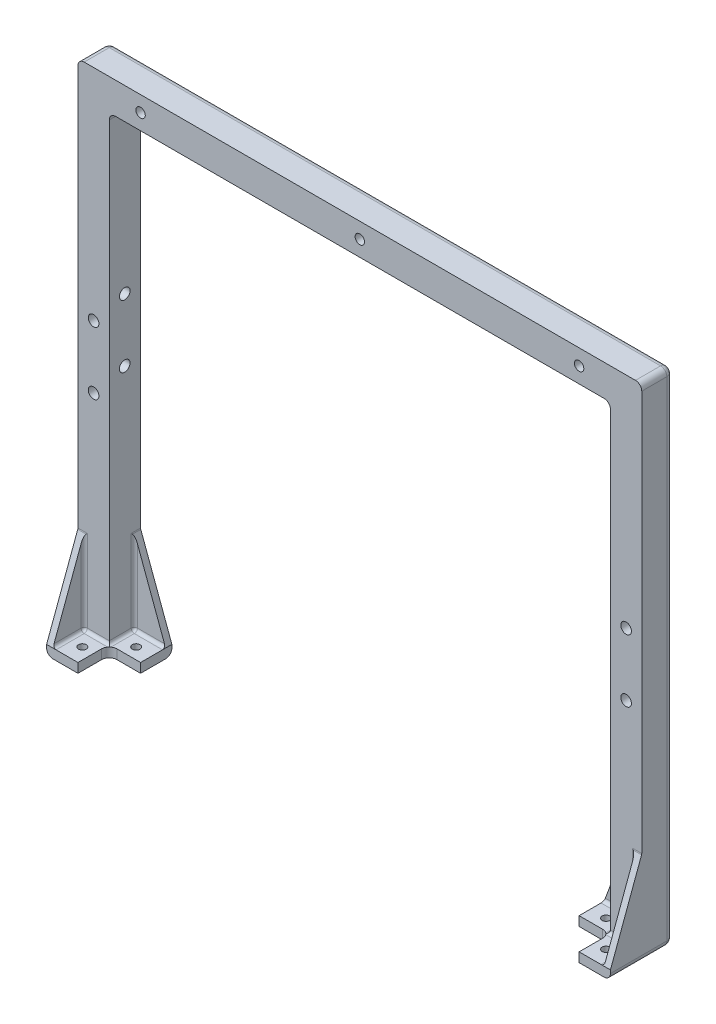
from build123d import *

# Parameters (mm, degrees)
FRAME_DEPTH                 = 12.7
GUSSET_SIDE_DEPTH           = 2.54
SKETCH4_W                   = 12.7
SKETCH4_H                   = 25.4
BOTTOM_MOUNT_PLATE_DEPTH    = 3.81
GUSSET_FRONT_DEPTH          = 2.54
SKETCH6_W                   = 25.4
SKETCH6_H                   = 12.7
BOTTOM_MOUNT_PLATE2_DEPTH   = 3.81
FILLET1_R                   = 1.27
FILLET2_R                   = 3.175
FILLET4_R                   = 1.27
SKETCH7_R                   = 1.5875
BOTTOM_MOUNTING_HOLES_DEPTH = 232.227208823
SKETCH8_R                   = 1.905
TOP_MOUNTINGHOLES_DEPTH     = 7.112
SKETCH9_R                   = 2.159
BRACE_MOUNTING_HOLES_DEPTH  = 7.112
SKETCH10_R                  = 2.159
CUT_EXTRUDE1_DEPTH          = 7.112
FILLET5_R                   = 2.54
FILLET6_R                   = 2.54
SKETCH11_R                  = 2.159
CUT_EXTRUDE2_DEPTH          = 7.112


with BuildPart() as part:
    # Sketch1 → Frame (new body)
    with BuildSketch(Plane.XY):
        Polygon((-101.6, 0), (-101.6, 190.5), (101.6, 190.5), (101.6, 0), (114.3, 0), (114.3, 203.2), (-114.3, 203.2), (-114.3, 0), align=None)
    extrude(amount=FRAME_DEPTH)

    # Sketch3 → gusset_side (add)
    with BuildSketch(Plane.ZY.offset(114.3)):
        Polygon((0, 0), (25.4, 0), (25.4, 3.81), (12.7, 38.1), (0, 38.1), align=None)
    gusset_side = extrude(amount=-GUSSET_SIDE_DEPTH)

    # gusset_mirror: gusset_side across plane
    add(gusset_side.mirror(Plane(origin=(0, 0, 0), x_dir=(0, 0, 1), z_dir=(1, 0, 0))))

    # Sketch4 → bottom_mount_plate (add)
    with BuildSketch(Plane(origin=(0, 0, 0), x_dir=(-1, 0, 0), z_dir=(0, -1, 0))):
        with Locations((107.95, -12.7)):
            Rectangle(SKETCH4_W, SKETCH4_H)
    bottom_mount_plate = extrude(amount=-BOTTOM_MOUNT_PLATE_DEPTH)

    # Mirror2: bottom_mount_plate across plane
    add(bottom_mount_plate.mirror(Plane(origin=(0, 0, 0), x_dir=(0, 0, 1), z_dir=(1, 0, 0))))

    # Sketch5 → gusset_front (add)
    with BuildSketch(Plane(origin=(0, 0, 0), x_dir=(-1, 0, 0), z_dir=(0, 0, -1))):
        Polygon((-114.3, 0), (-88.9, 0), (-88.9, 3.81), (-101.6, 38.1), (-114.3, 38.1), align=None)
    gusset_front = extrude(amount=-GUSSET_FRONT_DEPTH)

    # Mirror3: gusset_front across plane
    add(gusset_front.mirror(Plane(origin=(0, 0, 0), x_dir=(0, 0, 1), z_dir=(1, 0, 0))))

    # Sketch6 → bottom_mount_plate2 (add)
    with BuildSketch(Plane.XZ):
        with Locations((101.6, 6.35)):
            Rectangle(SKETCH6_W, SKETCH6_H)
    bottom_mount_plate2 = extrude(amount=-BOTTOM_MOUNT_PLATE2_DEPTH)

    # Mirror4: bottom_mount_plate2 across plane
    add(bottom_mount_plate2.mirror(Plane(origin=(0, 0, 0), x_dir=(0, 0, 1), z_dir=(1, 0, 0))))

    # Fillet1
    fillet1_edges = [part.edges().sort_by_distance(p)[0] for p in [
        (101.6, 38.1, 1.27),
        (-101.6, 20.955, 2.54),
        (-101.6, 38.1, 1.27),
        (101.6, 20.955, 2.54),
        (-113.03, 38.1, 12.7),
        (111.76, 20.955, 12.7),
        (113.03, 38.1, 12.7),
        (-111.76, 20.955, 12.7),
    ]]
    fillet(fillet1_edges, radius=FILLET1_R)

    # Fillet2
    # the kernel refuses this fillet: 3.175 mm, written as the material it adds along each edge
    with BuildSketch(Plane(origin=(101.6, 0, 12.7), x_dir=(-1, 0, 0), z_dir=(0, 1, 0))) as fillet2_piece_1:
        with BuildLine():
            CenterArc((FILLET2_R, FILLET2_R), FILLET2_R, 180, 90)
            Line((0, FILLET2_R), (0, 0))
            Line((0, 0), (FILLET2_R, 0))
        make_face()
    extrude(amount=3.81)
    with BuildSketch(Plane(origin=(-101.6, 0, 12.7), x_dir=(1, 0, 0), z_dir=(0, 1, 0))) as fillet2_piece_2:
        with BuildLine():
            CenterArc((FILLET2_R, -FILLET2_R), FILLET2_R, 90, 90)
            Line((0, -FILLET2_R), (0, 0))
            Line((0, 0), (FILLET2_R, 0))
        make_face()
    extrude(amount=3.81)

    # Fillet4
    # the kernel refuses this fillet: 1.27 mm, written as the material it adds along each edge
    with BuildSketch(Plane(origin=(88.9, 3.81, 2.54), x_dir=(0, 0, 1), z_dir=(1, 0, 0))) as fillet4_piece_1_section:
        with BuildLine():
            CenterArc((FILLET4_R, -FILLET4_R), FILLET4_R, 90, 90)
            Line((0, -FILLET4_R), (0, 0))
            Line((0, 0), (FILLET4_R, 0))
        make_face()
    fillet4_piece_1 = extrude(amount=11.43, mode=Mode.PRIVATE)
    fillet4_piece_1 = split(fillet4_piece_1, bisect_by=Plane(origin=(89.688624657, 5.939286574, 2.828959193), z_dir=(0.9377487607237037, -0.3473143558235941, 0)), keep=Keep.TOP, mode=Mode.PRIVATE)
    add(fillet4_piece_1)
    with BuildSketch(Plane(origin=(-101.6, 3.81, 3.81), x_dir=(1, 0, 0), z_dir=(0, 0, 1)), Plane(origin=(101.6, 3.81, 3.81), x_dir=(0, 1, 0), z_dir=(0, 0, 1))) as fillet4_piece_2:
        with BuildLine():
            CenterArc((FILLET4_R, FILLET4_R), FILLET4_R, 180, 90)
            Line((0, FILLET4_R), (0, 0))
            Line((0, 0), (FILLET4_R, 0))
        make_face()
    extrude(amount=8.89)
    with BuildSketch(Plane(origin=(110.49, 3.81, 12.7), x_dir=(0, 1, 0), z_dir=(-1, 0, 0)), Plane(origin=(-110.49, 3.81, 12.7), x_dir=(0, 0, 1), z_dir=(1, 0, 0))) as fillet4_piece_3:
        with BuildLine():
            CenterArc((FILLET4_R, -FILLET4_R), FILLET4_R, 90, 90)
            Line((0, -FILLET4_R), (0, 0))
            Line((0, 0), (FILLET4_R, 0))
        make_face()
    extrude(amount=8.89)
    with BuildSketch(Plane(origin=(100.33, 3.81, 3.81), x_dir=(0, 0, -1), z_dir=(-1, 0, 0))) as fillet4_piece_4:
        with BuildLine():
            CenterArc((1.27 - FILLET4_R, -FILLET4_R), FILLET4_R, 0, 90)
            Line((1.27, -FILLET4_R), (1.27, 0))
            Line((1.27, 0), (1.27 - FILLET4_R, 0))
        make_face()
    revolve(axis=Axis((100.33, 3.81, 3.81), (0, -1, 0)), revolution_arc=90)
    with BuildSketch(Plane(origin=(110.49, 3.81, 13.97), x_dir=(0, 0, -1), z_dir=(-1, 0, 0))) as fillet4_piece_5:
        with BuildLine():
            CenterArc((1.27 - FILLET4_R, -FILLET4_R), FILLET4_R, 0, 90)
            Line((1.27 - FILLET4_R, 0), (1.27, 0))
            Line((1.27, 0), (1.27, -FILLET4_R))
        make_face()
    revolve(axis=Axis((110.49, 3.81, 13.97), (0, -1, 0)), revolution_arc=90)
    with BuildSketch(Plane(origin=(-100.33, 3.81, 2.54), x_dir=(0, 0, 1), z_dir=(1, 0, 0))) as fillet4_piece_6_section:
        with BuildLine():
            CenterArc((FILLET4_R, -FILLET4_R), FILLET4_R, 90, 90)
            Line((0, -FILLET4_R), (0, 0))
            Line((0, 0), (FILLET4_R, 0))
        make_face()
    fillet4_piece_6 = extrude(amount=11.43, mode=Mode.PRIVATE)
    fillet4_piece_6 = split(fillet4_piece_6, bisect_by=Plane(origin=(-89.688624657, 5.939286574, 2.828959193), z_dir=(-0.9377487607237037, -0.3473143558235941, 0)), keep=Keep.TOP, mode=Mode.PRIVATE)
    add(fillet4_piece_6)
    with BuildSketch(Plane(origin=(-100.33, 3.81, 3.81), x_dir=(0, 0, -1), z_dir=(1, 0, 0))) as fillet4_piece_7:
        with BuildLine():
            CenterArc((1.27 - FILLET4_R, FILLET4_R), FILLET4_R, 270, 90)
            Line((1.27, FILLET4_R), (1.27, 0))
            Line((1.27, 0), (1.27 - FILLET4_R, 0))
        make_face()
    revolve(axis=Axis((-100.33, 3.81, 3.81), (0, 1, 0)), revolution_arc=90)
    with BuildSketch(Plane(origin=(-111.76, 3.81, 13.97), x_dir=(1, 0, 0), z_dir=(0, 0, 1))) as fillet4_piece_8_section:
        with BuildLine():
            CenterArc((FILLET4_R, FILLET4_R), FILLET4_R, 180, 90)
            Line((0, FILLET4_R), (0, 0))
            Line((0, 0), (FILLET4_R, 0))
        make_face()
    fillet4_piece_8 = extrude(amount=11.43, mode=Mode.PRIVATE)
    fillet4_piece_8 = split(fillet4_piece_8, bisect_by=Plane(origin=(-111.471040807, 5.939286574, 24.611375343), z_dir=(0, -0.34731435582359405, -0.9377487607237037)), keep=Keep.TOP, mode=Mode.PRIVATE)
    add(fillet4_piece_8)
    with BuildSketch(Plane(origin=(-110.49, 3.81, 13.97), x_dir=(0, 0, -1), z_dir=(1, 0, 0))) as fillet4_piece_9:
        with BuildLine():
            CenterArc((1.27 - FILLET4_R, FILLET4_R), FILLET4_R, 270, 90)
            Line((1.27, FILLET4_R), (1.27, 0))
            Line((1.27, 0), (1.27 - FILLET4_R, 0))
        make_face()
    revolve(axis=Axis((-110.49, 3.81, 13.97), (0, 1, 0)), revolution_arc=90)
    with BuildSketch(Plane(origin=(111.76, 3.81, 25.4), x_dir=(-1, 0, 0), z_dir=(0, 0, -1))) as fillet4_piece_10_section:
        with BuildLine():
            CenterArc((FILLET4_R, FILLET4_R), FILLET4_R, 180, 90)
            Line((0, FILLET4_R), (0, 0))
            Line((0, 0), (FILLET4_R, 0))
        make_face()
    fillet4_piece_10 = extrude(amount=11.43, mode=Mode.PRIVATE)
    fillet4_piece_10 = split(fillet4_piece_10, bisect_by=Plane(origin=(111.471040807, 5.939286574, 24.611375343), z_dir=(0, -0.34731435582359405, -0.9377487607237037)), keep=Keep.TOP, mode=Mode.PRIVATE)
    add(fillet4_piece_10)
    with BuildSketch(Plane(origin=(-110.49, 3.81, 12.7), x_dir=(0, 0, 1), z_dir=(1, 0, 0))) as fillet4_piece_11a_section:
        with BuildLine():
            CenterArc((FILLET4_R, -FILLET4_R), FILLET4_R, 90, 90)
            Line((0, -FILLET4_R), (0, 0))
            Line((0, 0), (FILLET4_R, 0))
        make_face()
    fillet4_piece_11a = extrude(amount=12.065, mode=Mode.PRIVATE)
    fillet4_piece_11a = fillet4_piece_11a - Plane(origin=(-98.425, 4.1527608, 15.875), x_dir=(1, 0, 0), z_dir=(0, -1, 0)) * Cylinder(3.175, 30, mode=Mode.PRIVATE)
    fillet4_piece_11a = split(fillet4_piece_11a, bisect_by=Plane(origin=(-101.6, 4.1527608, 12.907303318), z_dir=(1, 0, 0)), keep=Keep.TOP, mode=Mode.PRIVATE)
    with BuildSketch(Plane(origin=(-101.6, 3.81, 3.81), x_dir=(1, 0, 0), z_dir=(0, 0, 1))) as fillet4_piece_11b_section:
        with BuildLine():
            CenterArc((FILLET4_R, FILLET4_R), FILLET4_R, 180, 90)
            Line((0, FILLET4_R), (0, 0))
            Line((0, 0), (FILLET4_R, 0))
        make_face()
    fillet4_piece_11b = extrude(amount=12.065, mode=Mode.PRIVATE)
    fillet4_piece_11b = fillet4_piece_11b - Plane(origin=(-98.425, 4.152760851, 15.875), x_dir=(1, 0, 0), z_dir=(0, -1, 0)) * Cylinder(3.175, 30, mode=Mode.PRIVATE)
    fillet4_piece_11b = split(fillet4_piece_11b, bisect_by=Plane(origin=(-101.392696671, 4.152760851, 12.7), z_dir=(0, 0, 1)), keep=Keep.TOP, mode=Mode.PRIVATE)
    fillet4_piece_11 = fillet4_piece_11a & fillet4_piece_11b
    add(fillet4_piece_11)
    with BuildSketch(Plane(origin=(110.49, 3.81, 12.7), x_dir=(0, 1, 0), z_dir=(-1, 0, 0))) as fillet4_piece_12a_section:
        with BuildLine():
            CenterArc((FILLET4_R, -FILLET4_R), FILLET4_R, 90, 90)
            Line((0, -FILLET4_R), (0, 0))
            Line((0, 0), (FILLET4_R, 0))
        make_face()
    fillet4_piece_12a = extrude(amount=12.065, mode=Mode.PRIVATE)
    fillet4_piece_12a = split(fillet4_piece_12a, bisect_by=Plane(origin=(101.6, 4.15276082, 12.907303262), z_dir=(-1, 0, 0)), keep=Keep.TOP, mode=Mode.PRIVATE)
    fillet4_piece_12a = fillet4_piece_12a - Plane(origin=(98.425, 4.15276082, 15.875), x_dir=(-1, 0, 0), z_dir=(0, -1, 0)) * Cylinder(3.175, 30, mode=Mode.PRIVATE)
    with BuildSketch(Plane(origin=(101.6, 3.81, 3.81), x_dir=(0, 1, 0), z_dir=(0, 0, 1))) as fillet4_piece_12b_section:
        with BuildLine():
            CenterArc((FILLET4_R, FILLET4_R), FILLET4_R, 180, 90)
            Line((0, FILLET4_R), (0, 0))
            Line((0, 0), (FILLET4_R, 0))
        make_face()
    fillet4_piece_12b = extrude(amount=12.065, mode=Mode.PRIVATE)
    fillet4_piece_12b = split(fillet4_piece_12b, bisect_by=Plane(origin=(101.392696709, 4.15276098, 12.7), z_dir=(0, 0, 1)), keep=Keep.TOP, mode=Mode.PRIVATE)
    fillet4_piece_12b = fillet4_piece_12b - Plane(origin=(98.425, 4.15276098, 15.875), x_dir=(-1, 0, 0), z_dir=(0, -1, 0)) * Cylinder(3.175, 30, mode=Mode.PRIVATE)
    fillet4_piece_12 = fillet4_piece_12a & fillet4_piece_12b
    add(fillet4_piece_12)

    # Sketch7 → Bottom-Mounting-Holes (cut, through all)
    with BuildSketch(Plane(origin=(0, 3.81, 0), x_dir=(1, 0, 0), z_dir=(0, 1, 0))):
        with Locations(Location((-106.172, -19.05, 0), (0, 0, 270))):
            Circle(SKETCH7_R)
        with Locations(Location((-95.25, -8.128, 0), (0, 0, 270))):
            Circle(SKETCH7_R)
        with Locations(Location((95.25, -8.128, 0), (0, 0, 270))):
            Circle(SKETCH7_R)
        with Locations(Location((106.172, -19.05, 0), (0, 0, 270))):
            Circle(SKETCH7_R)
    extrude(amount=-BOTTOM_MOUNTING_HOLES_DEPTH, mode=Mode.SUBTRACT)

    # Sketch8 → Top-MountingHoles (cut)
    with BuildSketch(Plane.XY.offset(12.7)):
        with Locations((0, 196.85)):
            Circle(SKETCH8_R)
        with Locations((-88.9, 196.85)):
            Circle(SKETCH8_R)
        with Locations(Location((88.9, 196.85, 0), (0, 0, 180))):
            Circle(SKETCH8_R)
    extrude(amount=-TOP_MOUNTINGHOLES_DEPTH, mode=Mode.SUBTRACT)

    # Sketch9 → Brace-Mounting-Holes (cut)
    with BuildSketch(Plane.ZY.offset(-101.6)):
        with Locations((6.424414063, 123.825)):
            Circle(SKETCH9_R)
        with Locations((6.448226563, 98.425)):
            Circle(SKETCH9_R)
    brace_mounting_holes = extrude(amount=-BRACE_MOUNTING_HOLES_DEPTH, mode=Mode.SUBTRACT)

    # Mirror5: Brace-Mounting-Holes across plane
    add(brace_mounting_holes.mirror(Plane(origin=(0, 0, 0), x_dir=(0, 0, 1), z_dir=(1, 0, 0))), mode=Mode.SUBTRACT)

    # Sketch10 → Cut-Extrude1 (cut)
    with BuildSketch(Plane.XY.offset(12.7)):
        with Locations((-107.95, 114.3)):
            Circle(SKETCH10_R)
        with Locations((-107.95, 88.9)):
            Circle(SKETCH10_R)
        with Locations(Location((107.95, 88.9, 0), (0, 0, 180))):
            Circle(SKETCH10_R)
        with Locations(Location((107.95, 114.3, 0), (0, 0, 180))):
            Circle(SKETCH10_R)
    extrude(amount=-CUT_EXTRUDE1_DEPTH, mode=Mode.SUBTRACT)

    # Fillet5
    fillet5_edges = [part.edges().sort_by_distance(p)[0] for p in [
        (-101.6, 0, 0),
        (-114.3, 0, 12.7),
        (-114.3, 203.2, 6.35),
        (114.3, 203.2, 6.35),
        (114.3, 0, 12.7),
        (-114.3, 101.6, 0),
        (114.3, 101.6, 0),
        (101.6, 0, 0),
    ]]
    fillet(fillet5_edges, radius=FILLET5_R)

    # Fillet6
    # the kernel refuses this fillet: 2.54 mm, written as the material it adds along each edge
    with BuildSketch(Plane(origin=(101.6, 190.5, 0), x_dir=(-1, 0, 0), z_dir=(0, 0, 1)), Plane(origin=(-101.6, 190.5, 0), x_dir=(0, -1, 0), z_dir=(0, 0, 1))) as fillet6_piece_1:
        with BuildLine():
            CenterArc((FILLET6_R, FILLET6_R), FILLET6_R, 180, 90)
            Line((0, FILLET6_R), (0, 0))
            Line((0, 0), (FILLET6_R, 0))
        make_face()
    extrude(amount=12.7)
    # the kernel refuses this fillet: 2.54 mm, written as the material it takes off along each edge
    with BuildSketch(Plane(origin=(-111.76, 200.66, 2.54), x_dir=(0, 0, -1), z_dir=(0, 1, 0))) as fillet6_2_piece_1_section:
        Polygon((0, 0), (FILLET6_R, 0), (FILLET6_R, FILLET6_R), (0, FILLET6_R), align=None)
    fillet6_2_piece_1 = extrude(amount=FILLET6_R, mode=Mode.PRIVATE)
    fillet6_2_piece_1 = fillet6_2_piece_1 - Plane(origin=(-111.76, 200.66, 2.54), x_dir=(0.7071067811865475, 0, 0.7071067811865475), z_dir=(0, 1, 0)) * Sphere(FILLET6_R, mode=Mode.PRIVATE)
    add(fillet6_2_piece_1, mode=Mode.SUBTRACT)
    with BuildSketch(Plane(origin=(111.76, 200.66, 2.54), x_dir=(0, 0, -1), z_dir=(0, 1, 0))) as fillet6_2_piece_2_section:
        Polygon((0, 0), (FILLET6_R, 0), (FILLET6_R, -FILLET6_R), (0, -FILLET6_R), align=None)
    fillet6_2_piece_2 = extrude(amount=FILLET6_R, mode=Mode.PRIVATE)
    fillet6_2_piece_2 = fillet6_2_piece_2 - Plane(origin=(111.76, 200.66, 2.54), x_dir=(-0.7071067811865475, 0, 0.7071067811865475), z_dir=(0, 1, 0)) * Sphere(FILLET6_R, mode=Mode.PRIVATE)
    add(fillet6_2_piece_2, mode=Mode.SUBTRACT)
    with BuildSketch(Plane(origin=(111.76, 203.2, 0), x_dir=(0, 0, 1), z_dir=(-1, 0, 0))) as fillet6_2_piece_3:
        with BuildLine():
            CenterArc((FILLET6_R, -FILLET6_R), FILLET6_R, 90, 90)
            Line((0, -FILLET6_R), (0, 0))
            Line((0, 0), (FILLET6_R, 0))
        make_face()
    extrude(amount=223.52, mode=Mode.SUBTRACT)

    # Sketch11 → Cut-Extrude2 (cut)
    with BuildSketch(Plane.XZ.offset(-190.5)):
        with Locations(Location((-12.7, 6.35, 0), (0, 0, 270))):
            Circle(SKETCH11_R)
        with Locations(Location((12.7, 6.35, 0), (0, 0, 90))):
            Circle(SKETCH11_R)
    extrude(amount=-CUT_EXTRUDE2_DEPTH, mode=Mode.SUBTRACT)


solid = part.part
